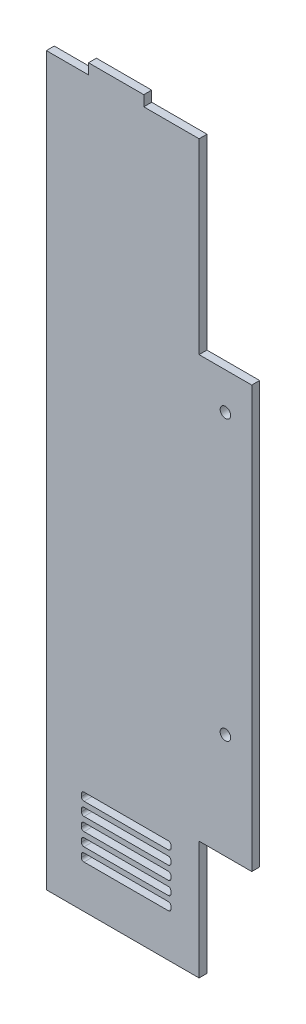
from build123d import *

# Parameters (mm, degrees)
SKETCH1_R           = 2
BOSS_EXTRUDE1_DEPTH = 3


with BuildPart() as part:
    # Sketch1 → Boss-Extrude1 (new body)
    with BuildSketch(Plane.XY):
        Polygon((18, -22.070954543), (18, 48.929045457), (-3, 48.929045457), (-3, 52.929045457), (-24, 52.929045457), (-24, 48.929045457), (-40, 48.929045457), (-40, -227.070954543), (18, -227.070954543), (18, -182.070954543), (38, -182.070954543), (38, -22.070954543), align=None)
        with Locations((28, -36.070954543)):
            Circle(SKETCH1_R, mode=Mode.SUBTRACT)
        with BuildLine():
            Line((-25.70047512, -207.785634012), (6.29952488, -207.785634012))
            ThreePointArc((6.29952488, -207.785634012), (7.006631662, -208.078527231), (7.29952488, -208.785634012))
            Line((7.29952488, -208.785634012), (7.29952488, -209.785634012))
            ThreePointArc((7.29952488, -209.785634012), (7.006631662, -210.492740793), (6.29952488, -210.785634012))
            Line((6.29952488, -210.785634012), (-25.70047512, -210.785634012))
            ThreePointArc((-25.70047512, -210.785634012), (-26.407581901, -210.492740793), (-26.70047512, -209.785634012))
            Line((-26.70047512, -209.785634012), (-26.70047512, -208.785634012))
            ThreePointArc((-26.70047512, -208.785634012), (-26.407581901, -208.078527231), (-25.70047512, -207.785634012))
        make_face(mode=Mode.SUBTRACT)
        with BuildLine():
            Line((-25.70047512, -202.785634012), (6.29952488, -202.785634012))
            ThreePointArc((6.29952488, -202.785634012), (7.006631662, -203.078527231), (7.29952488, -203.785634012))
            Line((7.29952488, -203.785634012), (7.29952488, -204.785634012))
            ThreePointArc((7.29952488, -204.785634012), (7.006631662, -205.492740793), (6.29952488, -205.785634012))
            Line((6.29952488, -205.785634012), (-25.70047512, -205.785634012))
            ThreePointArc((-25.70047512, -205.785634012), (-26.407581901, -205.492740793), (-26.70047512, -204.785634012))
            Line((-26.70047512, -204.785634012), (-26.70047512, -203.785634012))
            ThreePointArc((-26.70047512, -203.785634012), (-26.407581901, -203.078527231), (-25.70047512, -202.785634012))
        make_face(mode=Mode.SUBTRACT)
        with BuildLine():
            Line((-25.70047512, -197.785634012), (6.29952488, -197.785634012))
            ThreePointArc((6.29952488, -197.785634012), (7.006631662, -198.078527231), (7.29952488, -198.785634012))
            Line((7.29952488, -198.785634012), (7.29952488, -199.785634012))
            ThreePointArc((7.29952488, -199.785634012), (7.006631662, -200.492740793), (6.29952488, -200.785634012))
            Line((6.29952488, -200.785634012), (-25.70047512, -200.785634012))
            ThreePointArc((-25.70047512, -200.785634012), (-26.407581901, -200.492740793), (-26.70047512, -199.785634012))
            Line((-26.70047512, -199.785634012), (-26.70047512, -198.785634012))
            ThreePointArc((-26.70047512, -198.785634012), (-26.407581901, -198.078527231), (-25.70047512, -197.785634012))
        make_face(mode=Mode.SUBTRACT)
        with BuildLine():
            Line((-25.70047512, -192.785634012), (6.29952488, -192.785634012))
            ThreePointArc((6.29952488, -192.785634012), (7.006631662, -193.078527231), (7.29952488, -193.785634012))
            Line((7.29952488, -193.785634012), (7.29952488, -194.785634012))
            ThreePointArc((7.29952488, -194.785634012), (7.006631662, -195.492740793), (6.29952488, -195.785634012))
            Line((6.29952488, -195.785634012), (-25.70047512, -195.785634012))
            ThreePointArc((-25.70047512, -195.785634012), (-26.407581901, -195.492740793), (-26.70047512, -194.785634012))
            Line((-26.70047512, -194.785634012), (-26.70047512, -193.785634012))
            ThreePointArc((-26.70047512, -193.785634012), (-26.407581901, -193.078527231), (-25.70047512, -192.785634012))
        make_face(mode=Mode.SUBTRACT)
        with BuildLine():
            Line((-25.70047512, -187.785634012), (6.29952488, -187.785634012))
            ThreePointArc((6.29952488, -187.785634012), (7.006631662, -188.078527231), (7.29952488, -188.785634012))
            Line((7.29952488, -188.785634012), (7.29952488, -189.785634012))
            ThreePointArc((7.29952488, -189.785634012), (7.006631662, -190.492740793), (6.29952488, -190.785634012))
            Line((6.29952488, -190.785634012), (-25.70047512, -190.785634012))
            ThreePointArc((-25.70047512, -190.785634012), (-26.407581901, -190.492740793), (-26.70047512, -189.785634012))
            Line((-26.70047512, -189.785634012), (-26.70047512, -188.785634012))
            ThreePointArc((-26.70047512, -188.785634012), (-26.407581901, -188.078527231), (-25.70047512, -187.785634012))
        make_face(mode=Mode.SUBTRACT)
        with Locations((28, -142.070954543)):
            Circle(SKETCH1_R, mode=Mode.SUBTRACT)
    extrude(amount=BOSS_EXTRUDE1_DEPTH)


solid = part.part
